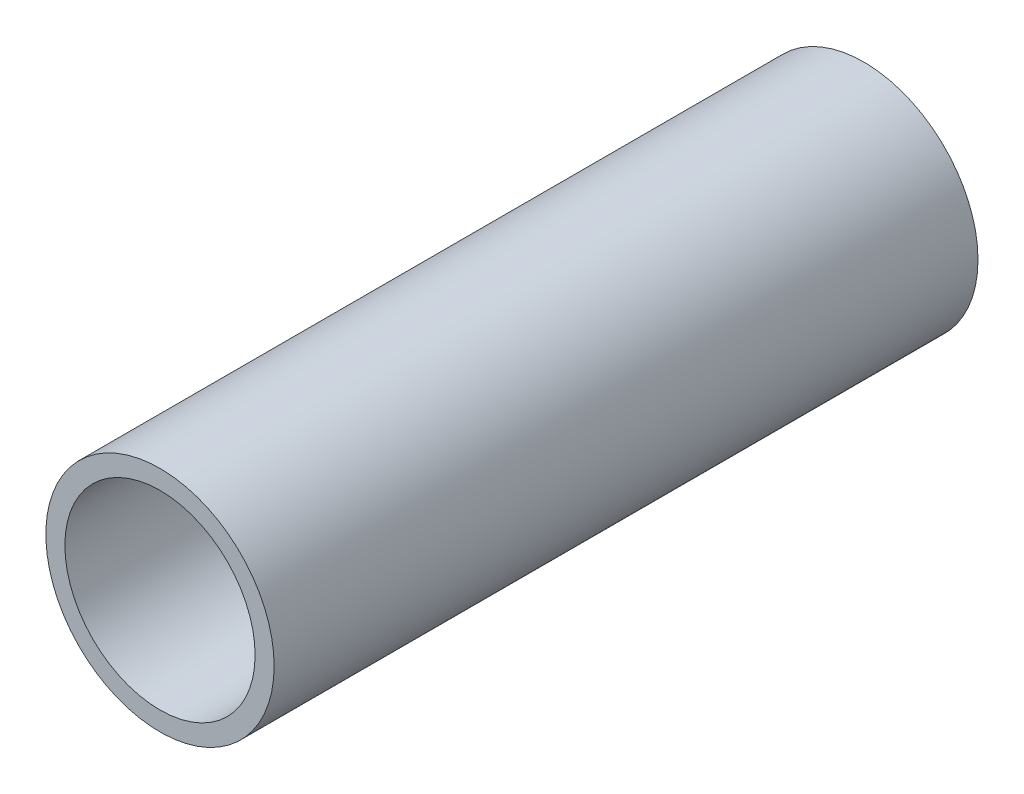
from build123d import *

# Parameters (mm, degrees)
ESQUISSE1_R        = 6
ESQUISSE1_R_2      = 5
BOSS_EXTRU_1_DEPTH = 37


with BuildPart() as part:
    # Esquisse1 → Boss.-Extru.1 (new body)
    with BuildSketch(Plane.XY):
        Circle(ESQUISSE1_R)
        Circle(ESQUISSE1_R_2, mode=Mode.SUBTRACT)
    extrude(amount=BOSS_EXTRU_1_DEPTH)


solid = part.part
